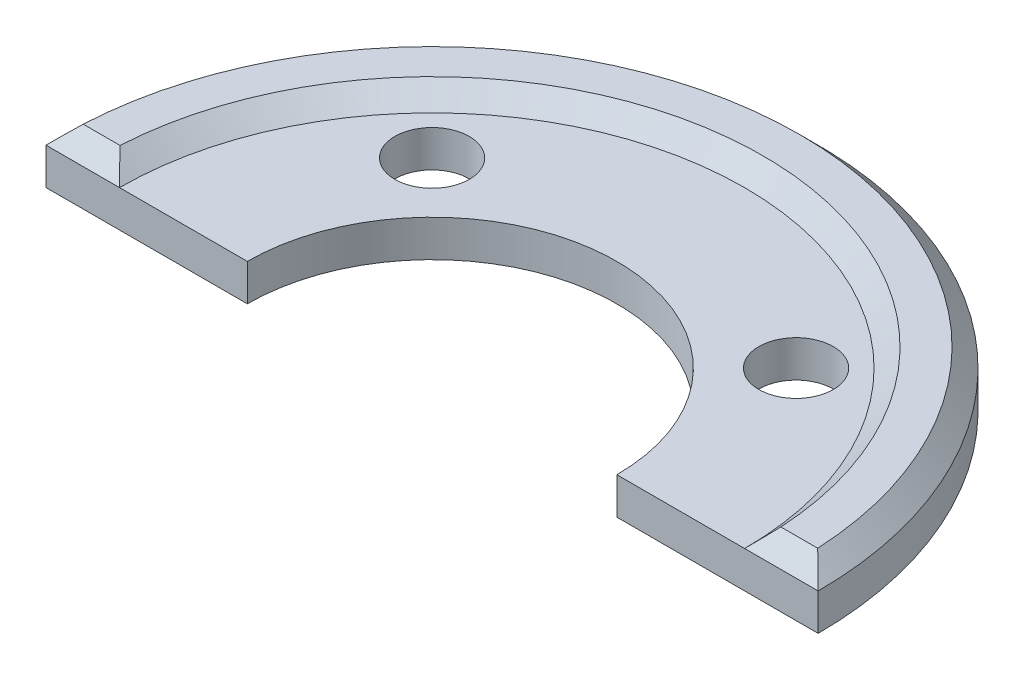
from build123d import *

# Parameters (mm, degrees)
EXTRUDE_1_DEPTH               = 3
HOLE_WIZARD_M2_1_AT_2_COUNT   = 2
HOLE_WIZARD_M2_1_AT_2_PITCH   = 21
PATTERN_LINEAR_1_COUNT        = 3
PATTERN_LINEAR_1_PITCH        = 33
PATTERN_LINEAR_2_COUNT        = 3
PATTERN_LINEAR_2_PITCH        = 10.5
PATTERN_LINEAR_3_COUNT        = 2
PATTERN_LINEAR_3_PITCH        = 31.5
HOLE_WIZARD_M2_1_2_AT_2_COUNT = 2
HOLE_WIZARD_M2_1_2_AT_2_PITCH = 16.970562748
SKETCH_8_R                    = 17
CUT_EXTRUDE_1_DEPTH           = 1
SKETCH_9_R                    = 2.025
CUT_EXTRUDE_2_DEPTH           = 75.994999833
PATTERN_CIRCULAR_1_COUNT      = 2
PATTERN_CIRCULAR_1_ANGLE      = 90
FILLET_1_R                    = 4
CUT_EXTRUDE_3_DEPTH           = 76.028327984
CHAMFER_2_SIZE                = 1


with BuildPart() as part:
    # ｽｹｯﾁ1 → ﾎﾞｽ - 押し出し1 (new body)
    with BuildSketch(Plane(origin=(0, 0, 0), x_dir=(1, 0, 0), z_dir=(0, 1, 0))):
        with BuildLine():
            Line((-10.05, 0), (-39, 0))
            Line((-39, 0), (-47.5, 8.5))
            Line((-47.5, 8.5), (-47.5, 58))
            Line((-47.5, 58), (47.5, 58))
            Line((47.5, 58), (47.5, 8.5))
            Line((47.5, 8.5), (39, 0))
            Line((39, 0), (10.05, 0))
            ThreePointArc((10.05, 0), (0, 10.05), (-10.05, 0))
        make_face()
    extrude(amount=EXTRUDE_1_DEPTH)

    # ｽｹｯﾁ3 → Hole Wizard M2 _1 (revolve, cut)
    with BuildSketch(Plane(origin=(-43.5, 3, -54), x_dir=(0, 0, 1), z_dir=(1, 0, 0))):
        Polygon((0, 0), (0, 4.63090365), (1.05, 4), (1.05, 1), (2, 1), (2, 0), align=None)
    hole_wizard_m2_1 = revolve(axis=Axis((-43.5, 9.35, -54), (0, -1, 0)), mode=Mode.SUBTRACT)

    # Hole Wizard M2 _1 at 2: Hole Wizard M2 _1 ×2
    with Locations(*[(i * HOLE_WIZARD_M2_1_AT_2_PITCH, 0, 0) for i in range(1, HOLE_WIZARD_M2_1_AT_2_COUNT)]):
        add(hole_wizard_m2_1, mode=Mode.SUBTRACT)

    # 直線ﾊﾟﾀｰﾝ1: Hole Wizard M2 _1 ×3
    with Locations(*[(i * PATTERN_LINEAR_1_PITCH, 0, 0) for i in range(1, PATTERN_LINEAR_1_COUNT)]):
        add(hole_wizard_m2_1, mode=Mode.SUBTRACT)

    # 直線ﾊﾟﾀｰﾝ1 copy 1 sketch → 直線ﾊﾟﾀｰﾝ1 copy 1 (revolve, cut)
    with BuildSketch(Plane(origin=(10.5, 3, -54), x_dir=(0, 0, 1), z_dir=(1, 0, 0))):
        Polygon((0, 0), (0, 4.63090365), (1.05, 4), (1.05, 1), (2, 1), (2, 0), align=None)
    revolve(axis=Axis((10.5, 9.35, -54), (0, -1, 0)), mode=Mode.SUBTRACT)

    # 直線ﾊﾟﾀｰﾝ1 copy 2 sketch → 直線ﾊﾟﾀｰﾝ1 copy 2 (revolve, cut)
    with BuildSketch(Plane(origin=(43.5, 3, -54), x_dir=(0, 0, 1), z_dir=(1, 0, 0))):
        Polygon((0, 0), (0, 4.63090365), (1.05, 4), (1.05, 1), (2, 1), (2, 0), align=None)
    revolve(axis=Axis((43.5, 9.35, -54), (0, -1, 0)), mode=Mode.SUBTRACT)

    # 直線ﾊﾟﾀｰﾝ2: Hole Wizard M2 _1 ×3
    with Locations(*[(0, 0, i * PATTERN_LINEAR_2_PITCH) for i in range(1, PATTERN_LINEAR_2_COUNT)]):
        add(hole_wizard_m2_1, mode=Mode.SUBTRACT)

    # 直線ﾊﾟﾀｰﾝ2 copy 1 sketch → 直線ﾊﾟﾀｰﾝ2 copy 1 (revolve, cut)
    with BuildSketch(Plane(origin=(-22.5, 3, -43.5), x_dir=(0, 0, 1), z_dir=(1, 0, 0))):
        Polygon((0, 0), (0, 4.63090365), (1.05, 4), (1.05, 1), (2, 1), (2, 0), align=None)
    revolve(axis=Axis((-22.5, 9.35, -43.5), (0, -1, 0)), mode=Mode.SUBTRACT)

    # 直線ﾊﾟﾀｰﾝ2 copy 2 sketch → 直線ﾊﾟﾀｰﾝ2 copy 2 (revolve, cut)
    with BuildSketch(Plane(origin=(-22.5, 3, -33), x_dir=(0, 0, 1), z_dir=(1, 0, 0))):
        Polygon((0, 0), (0, 4.63090365), (1.05, 4), (1.05, 1), (2, 1), (2, 0), align=None)
    revolve(axis=Axis((-22.5, 9.35, -33), (0, -1, 0)), mode=Mode.SUBTRACT)

    # 直線ﾊﾟﾀｰﾝ2 copy 3 sketch → 直線ﾊﾟﾀｰﾝ2 copy 3 (revolve, cut)
    with BuildSketch(Plane(origin=(-10.5, 3, -43.5), x_dir=(0, 0, 1), z_dir=(1, 0, 0))):
        Polygon((0, 0), (0, 4.63090365), (1.05, 4), (1.05, 1), (2, 1), (2, 0), align=None)
    revolve(axis=Axis((-10.5, 9.35, -43.5), (0, -1, 0)), mode=Mode.SUBTRACT)

    # 直線ﾊﾟﾀｰﾝ2 copy 4 sketch → 直線ﾊﾟﾀｰﾝ2 copy 4 (revolve, cut)
    with BuildSketch(Plane(origin=(-10.5, 3, -33), x_dir=(0, 0, 1), z_dir=(1, 0, 0))):
        Polygon((0, 0), (0, 4.63090365), (1.05, 4), (1.05, 1), (2, 1), (2, 0), align=None)
    revolve(axis=Axis((-10.5, 9.35, -33), (0, -1, 0)), mode=Mode.SUBTRACT)

    # 直線ﾊﾟﾀｰﾝ2 copy 5 sketch → 直線ﾊﾟﾀｰﾝ2 copy 5 (revolve, cut)
    with BuildSketch(Plane(origin=(22.5, 3, -43.5), x_dir=(0, 0, 1), z_dir=(1, 0, 0))):
        Polygon((0, 0), (0, 4.63090365), (1.05, 4), (1.05, 1), (2, 1), (2, 0), align=None)
    revolve(axis=Axis((22.5, 9.35, -43.5), (0, -1, 0)), mode=Mode.SUBTRACT)

    # 直線ﾊﾟﾀｰﾝ2 copy 6 sketch → 直線ﾊﾟﾀｰﾝ2 copy 6 (revolve, cut)
    with BuildSketch(Plane(origin=(22.5, 3, -33), x_dir=(0, 0, 1), z_dir=(1, 0, 0))):
        Polygon((0, 0), (0, 4.63090365), (1.05, 4), (1.05, 1), (2, 1), (2, 0), align=None)
    revolve(axis=Axis((22.5, 9.35, -33), (0, -1, 0)), mode=Mode.SUBTRACT)

    # 直線ﾊﾟﾀｰﾝ2 copy 7 sketch → 直線ﾊﾟﾀｰﾝ2 copy 7 (revolve, cut)
    with BuildSketch(Plane(origin=(10.5, 3, -43.5), x_dir=(0, 0, 1), z_dir=(1, 0, 0))):
        Polygon((0, 0), (0, 4.63090365), (1.05, 4), (1.05, 1), (2, 1), (2, 0), align=None)
    revolve(axis=Axis((10.5, 9.35, -43.5), (0, -1, 0)), mode=Mode.SUBTRACT)

    # 直線ﾊﾟﾀｰﾝ2 copy 8 sketch → 直線ﾊﾟﾀｰﾝ2 copy 8 (revolve, cut)
    with BuildSketch(Plane(origin=(10.5, 3, -33), x_dir=(0, 0, 1), z_dir=(1, 0, 0))):
        Polygon((0, 0), (0, 4.63090365), (1.05, 4), (1.05, 1), (2, 1), (2, 0), align=None)
    revolve(axis=Axis((10.5, 9.35, -33), (0, -1, 0)), mode=Mode.SUBTRACT)

    # 直線ﾊﾟﾀｰﾝ2 copy 9 sketch → 直線ﾊﾟﾀｰﾝ2 copy 9 (revolve, cut)
    with BuildSketch(Plane(origin=(43.5, 3, -43.5), x_dir=(0, 0, 1), z_dir=(1, 0, 0))):
        Polygon((0, 0), (0, 4.63090365), (1.05, 4), (1.05, 1), (2, 1), (2, 0), align=None)
    revolve(axis=Axis((43.5, 9.35, -43.5), (0, -1, 0)), mode=Mode.SUBTRACT)

    # 直線ﾊﾟﾀｰﾝ2 copy 10 sketch → 直線ﾊﾟﾀｰﾝ2 copy 10 (revolve, cut)
    with BuildSketch(Plane(origin=(43.5, 3, -33), x_dir=(0, 0, 1), z_dir=(1, 0, 0))):
        Polygon((0, 0), (0, 4.63090365), (1.05, 4), (1.05, 1), (2, 1), (2, 0), align=None)
    revolve(axis=Axis((43.5, 9.35, -33), (0, -1, 0)), mode=Mode.SUBTRACT)

    # 直線ﾊﾟﾀｰﾝ3: Hole Wizard M2 _1 ×2
    with Locations(*[(0, 0, i * PATTERN_LINEAR_3_PITCH) for i in range(1, PATTERN_LINEAR_3_COUNT)]):
        add(hole_wizard_m2_1, mode=Mode.SUBTRACT)

    # 直線ﾊﾟﾀｰﾝ3 copy 1 sketch → 直線ﾊﾟﾀｰﾝ3 copy 1 (revolve, cut)
    with BuildSketch(Plane(origin=(-22.5, 3, -22.5), x_dir=(0, 0, 1), z_dir=(1, 0, 0))):
        Polygon((0, 0), (0, 4.63090365), (1.05, 4), (1.05, 1), (2, 1), (2, 0), align=None)
    revolve(axis=Axis((-22.5, 9.35, -22.5), (0, -1, 0)), mode=Mode.SUBTRACT)

    # ｽｹｯﾁ5 → Hole Wizard M2 _1 2 (revolve, cut)
    with BuildSketch(Plane(origin=(-10.5, 3, -22.5), x_dir=(0, 0, 1), z_dir=(1, 0, 0))):
        Polygon((0, 0), (0, 6.480688495), (0.8, 6), (0.8, 0), align=None)
    hole_wizard_m2_1_2 = revolve(axis=Axis((-10.5, 9.35, -22.5), (0, -1, 0)), mode=Mode.SUBTRACT)

    # Hole Wizard M2 _1 2 at 2: Hole Wizard M2 _1 2 ×2
    with Locations(*[Vector(-0.7071067811865469, 0, 0.7071067811865482) * (i * HOLE_WIZARD_M2_1_2_AT_2_PITCH) for i in range(1, HOLE_WIZARD_M2_1_2_AT_2_COUNT)]):
        add(hole_wizard_m2_1_2, mode=Mode.SUBTRACT)

    # ｽｹｯﾁ7 → M2 なべ頭ねじ用座ぐり穴2 (revolve, cut)
    with BuildSketch(Plane(origin=(-43.5, 3, -12), x_dir=(0, 0, 1), z_dir=(1, 0, 0))):
        Polygon((0, 0), (0, 6.63090365), (1.05, 6), (1.05, 1), (2, 1), (2, 0), align=None)
    hole_wizard_m2_2 = revolve(axis=Axis((-43.5, 9.35, -12), (0, -1, 0)), mode=Mode.SUBTRACT)

    # ﾐﾗｰ1: Hole Wizard M2 _1 2, M2 なべ頭ねじ用座ぐり穴2 across plane
    add(hole_wizard_m2_1_2.mirror(Plane(origin=(0, 0, 0), x_dir=(0, 0, 1), z_dir=(1, 0, 0))), mode=Mode.SUBTRACT)
    add(hole_wizard_m2_2.mirror(Plane(origin=(0, 0, 0), x_dir=(0, 0, 1), z_dir=(1, 0, 0))), mode=Mode.SUBTRACT)

    # ﾐﾗｰ1 copy 1 sketch → ﾐﾗｰ1 copy 1 (revolve, cut)
    with BuildSketch(Plane(origin=(43.5, 3, -22.5), x_dir=(0, 0, 1), z_dir=(-1, 0, 0))):
        Polygon((0, 0), (0, -4.63090365), (1.05, -4), (1.05, -1), (2, -1), (2, 0), align=None)
    revolve(axis=Axis((43.5, 9.35, -22.5), (0, 1, 0)), mode=Mode.SUBTRACT)

    # ﾐﾗｰ1 copy 2 sketch → ﾐﾗｰ1 copy 2 (revolve, cut)
    with BuildSketch(Plane(origin=(22.5, 3, -22.5), x_dir=(0, 0, 1), z_dir=(-1, 0, 0))):
        Polygon((0, 0), (0, -4.63090365), (1.05, -4), (1.05, -1), (2, -1), (2, 0), align=None)
    revolve(axis=Axis((22.5, 9.35, -22.5), (0, 1, 0)), mode=Mode.SUBTRACT)

    # ﾐﾗｰ1 copy 3 sketch → ﾐﾗｰ1 copy 3 (revolve, cut)
    with BuildSketch(Plane(origin=(43.5, 3, -54), x_dir=(0, 0, 1), z_dir=(-1, 0, 0))):
        Polygon((0, 0), (0, -4.63090365), (1.05, -4), (1.05, -1), (2, -1), (2, 0), align=None)
    revolve(axis=Axis((43.5, 9.35, -54), (0, 1, 0)), mode=Mode.SUBTRACT)

    # ﾐﾗｰ1 copy 4 sketch → ﾐﾗｰ1 copy 4 (revolve, cut)
    with BuildSketch(Plane(origin=(22.5, 3, -54), x_dir=(0, 0, 1), z_dir=(-1, 0, 0))):
        Polygon((0, 0), (0, -4.63090365), (1.05, -4), (1.05, -1), (2, -1), (2, 0), align=None)
    revolve(axis=Axis((22.5, 9.35, -54), (0, 1, 0)), mode=Mode.SUBTRACT)

    # ﾐﾗｰ1 copy 5 sketch → ﾐﾗｰ1 copy 5 (revolve, cut)
    with BuildSketch(Plane(origin=(22.5, 3, -10.5), x_dir=(0, 0, 1), z_dir=(-1, 0, 0))):
        Polygon((0, 0), (0, -6.480688495), (0.8, -6), (0.8, 0), align=None)
    revolve(axis=Axis((22.5, 9.35, -10.5), (0, 1, 0)), mode=Mode.SUBTRACT)

    # ｽｹｯﾁ8 → ｶｯﾄ - 押し出し1 (cut)
    with BuildSketch(Plane(origin=(0, 3, 0), x_dir=(1, 0, 0), z_dir=(0, 1, 0))):
        Circle(SKETCH_8_R)
    extrude(amount=-CUT_EXTRUDE_1_DEPTH, mode=Mode.SUBTRACT)

    # ｽｹｯﾁ9 → ｶｯﾄ - 押し出し2 (cut, through all)
    with BuildSketch(Plane(origin=(0, 2, 0), x_dir=(1, 0, 0), z_dir=(0, 1, 0))):
        with Locations(Location((-9.899494937, 9.899494937, 0), (0, 0, 270))):
            Circle(SKETCH_9_R)
    cut_extrude_2 = extrude(amount=-CUT_EXTRUDE_2_DEPTH, mode=Mode.SUBTRACT)

    # 円形ﾊﾟﾀｰﾝ1: ｶｯﾄ - 押し出し2 ×2 about axis
    pattern_circular_1_axis = Axis((0, 3, 0), (0, -1, 0))
    for i in range(1, PATTERN_CIRCULAR_1_COUNT):
        add(cut_extrude_2.rotate(pattern_circular_1_axis, i * PATTERN_CIRCULAR_1_ANGLE / (PATTERN_CIRCULAR_1_COUNT - 1)), mode=Mode.SUBTRACT)

    # ﾌｨﾚｯﾄ1
    fillet_1_edges = [part.edges().sort_by_distance(p)[0] for p in [
        (-47.5, 1.5, -8.5),
        (-47.5, 1.5, -58),
        (47.5, 1.5, -58),
        (47.5, 1.5, -8.5),
        (39, 1.5, 0),
        (-39, 1.5, 0),
    ]]
    fillet(fillet_1_edges, radius=FILLET_1_R)

    # ｽｹｯﾁ10 → ｶｯﾄ - 押し出し3 (cut, through all)
    with BuildSketch(Plane(origin=(0, 3, 0), x_dir=(1, 0, 0), z_dir=(0, 1, 0))):
        with BuildLine():
            Line((-47.5, 0), (-21, 0))
            ThreePointArc((-21, 0), (0, 21), (21, 0))
            Line((21, 0), (47.5, 0))
            Line((47.5, 0), (47.5, 58))
            Line((47.5, 58), (-47.5, 58))
            Line((-47.5, 58), (-47.5, 0))
        make_face()
    extrude(amount=-CUT_EXTRUDE_3_DEPTH, mode=Mode.SUBTRACT)

    # 面取り2
    chamfer_2_edges = [part.edges().sort_by_distance(p)[0] for p in [
        (19, 3, 0),
        (0, 3, -17),
        (-19, 3, 0),
        (0, 3, -21),
    ]]
    chamfer(chamfer_2_edges, length=CHAMFER_2_SIZE - 0.0001)  # a hair under: the kernel refuses the full size


solid = part.part
